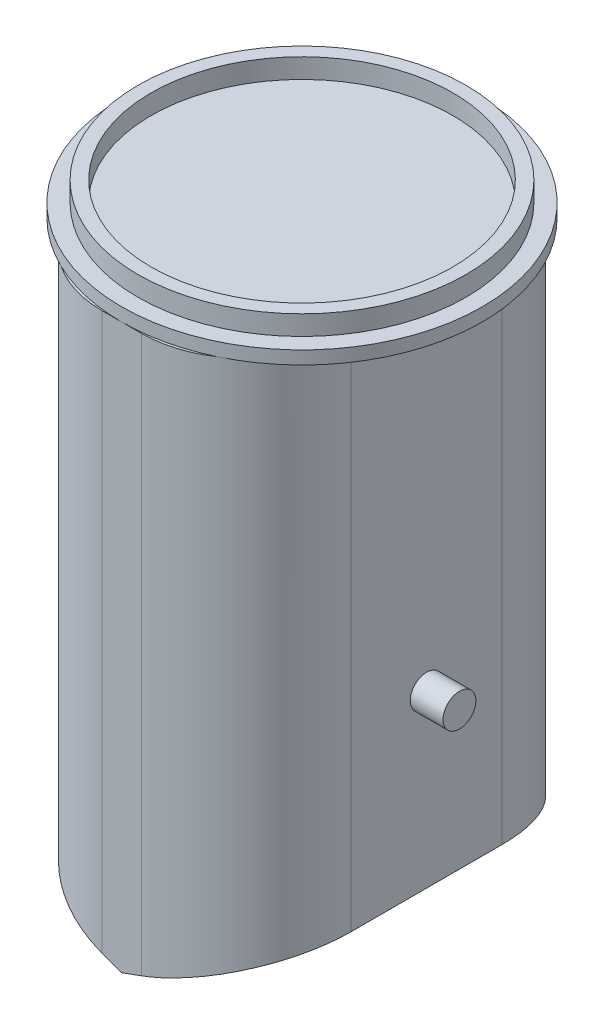
from build123d import *

# Parameters (mm, degrees)
SKETCH1_R           = 27.5
BOSS_EXTRUDE1_DEPTH = 2
SKETCH2_R           = 25
SKETCH2_R_2         = 23
BOSS_EXTRUDE2_DEPTH = 3
BOSS_EXTRUDE3_DEPTH = 87
CHAMFER2_SIZE       = 8
CHAMFER2_SIZE_2     = 21.979819356
SKETCH5_R           = 2.5
BOSS_EXTRUDE4_DEPTH = 5


with BuildPart() as part:
    # Sketch1 → Boss-Extrude1 (new body)
    with BuildSketch(Plane(origin=(0, 0, 0), x_dir=(1, 0, 0), z_dir=(0, 1, 0))):
        with Locations(Location((0, 0, 0), (0, 0, 270))):
            Circle(SKETCH1_R)
    extrude(amount=BOSS_EXTRUDE1_DEPTH)

    # Sketch2 → Boss-Extrude2 (add)
    with BuildSketch(Plane(origin=(0, 2, 0), x_dir=(1, 0, 0), z_dir=(0, 1, 0))):
        with Locations(Location((0, 0, 0), (0, 0, 270))):
            Circle(SKETCH2_R)
        with Locations(Location((0, 0, 0), (0, 0, 270))):
            Circle(SKETCH2_R_2, mode=Mode.SUBTRACT)
    extrude(amount=BOSS_EXTRUDE2_DEPTH)

    # Sketch3 → Boss-Extrude3 (add)
    with BuildSketch(Plane.XZ):
        with BuildLine():
            Line((3, -27.5), (-3, -27.5))
            ThreePointArc((-3, -27.5), (-14.313708499, -22.813708499), (-19, -11.5))
            Line((-19, -11.5), (-19, 11.5))
            ThreePointArc((-19, 11.5), (-14.313708499, 22.813708499), (-3, 27.5))
            Line((-3, 27.5), (3, 27.5))
            ThreePointArc((3, 27.5), (14.313708499, 22.813708499), (19, 11.5))
            Line((19, 11.5), (19, -11.5))
            ThreePointArc((19, -11.5), (14.313708499, -22.813708499), (3, -27.5))
        make_face()
    extrude(amount=BOSS_EXTRUDE3_DEPTH)

    # Chamfer2
    # the kernel refuses this chamfer: 21.979819356, 8 mm, written as the material it takes off along each edge
    with BuildSketch(Plane(origin=(19, -87, 68.519931595), x_dir=(0.0990409022520504, 0.9950833631817486, 0), z_dir=(0, 0, -1)), Plane(origin=(-19, -87, -68.519931595), x_dir=(-0.0990409022520504, 0.9950833631817486, 0), z_dir=(0, 0, 1))) as chamfer2_piece_1:
        Polygon((CHAMFER2_SIZE * 0.995083363182, -CHAMFER2_SIZE * 0.0990409022521), (-CHAMFER2_SIZE_2 * 0.0990409022504, -CHAMFER2_SIZE_2 * 0.995083363165), (0, 0), align=None)
    extrude(amount=137.03986319, mode=Mode.SUBTRACT)

    # Sketch5 → Boss-Extrude4 (add)
    with BuildSketch(Plane.ZY.offset(19)):
        with Locations(Location((0, -53, 0), (0, 0, 180))):
            Circle(SKETCH5_R)
    boss_extrude4 = extrude(amount=BOSS_EXTRUDE4_DEPTH)

    # Mirror1: Boss-Extrude4 across plane
    add(boss_extrude4.mirror(Plane(origin=(0, 0, 0), x_dir=(0, 0, 1), z_dir=(1, 0, 0))))


solid = part.part
